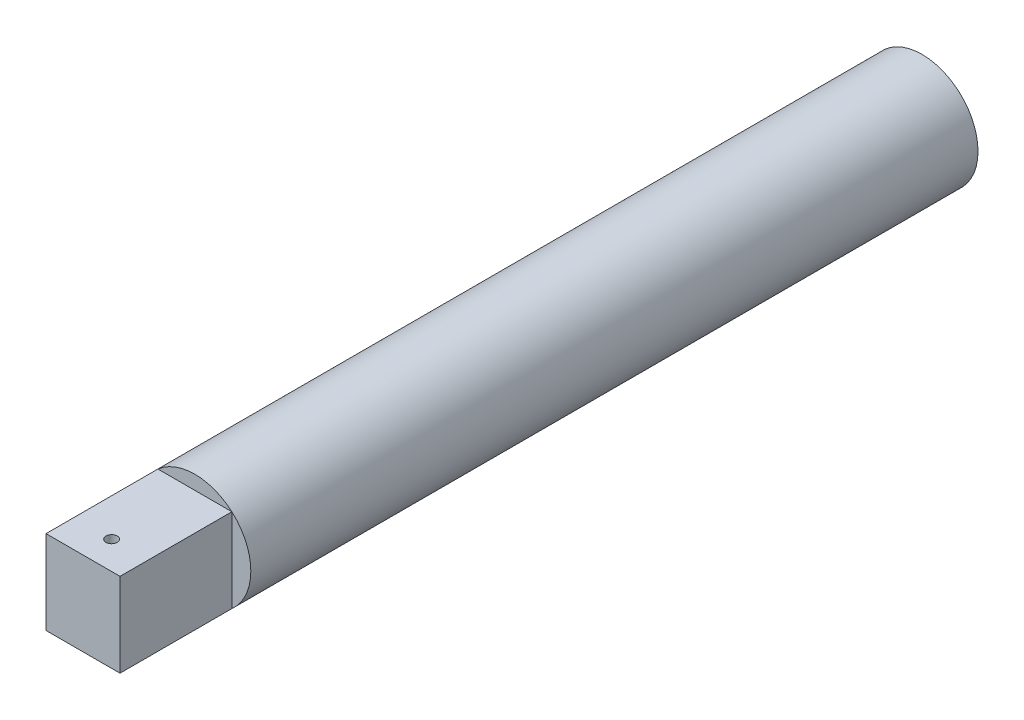
from build123d import *

# Parameters (mm, degrees)
SKETCH1_R           = 10
BOSS_EXTRUDE1_DEPTH = 150
CUT_EXTRUDE1_START  = -20
CUT_EXTRUDE1_DEPTH  = 20
SKETCH3_3_R         = 1
CUT_EXTRUDE4_DEPTH  = 152.348108677
SKETCH7_R           = 1
CUT_EXTRUDE5_DEPTH  = 10


with BuildPart() as part:
    # Sketch1 → Boss-Extrude1 (new body)
    with BuildSketch(Plane.XY):
        Circle(SKETCH1_R)
    extrude(amount=BOSS_EXTRUDE1_DEPTH)

    # Sketch2 → Cut-Extrude1 (cut)
    with BuildSketch(Plane.XY.offset(150).offset(CUT_EXTRUDE1_START)):
        with BuildLine():
            ThreePointArc((6.614378278, 7.5), (0, 10), (-6.614378278, 7.5))
            Line((-6.614378278, 7.5), (6.614378278, 7.5))
        make_face()
        with BuildLine():
            Line((-6.614378278, -7.5), (-6.614378278, 7.5))
            ThreePointArc((-6.614378278, 7.5), (-10, 0), (-6.614378278, -7.5))
        make_face()
        with BuildLine():
            ThreePointArc((6.614378278, -7.5), (10, 0), (6.614378278, 7.5))
            Line((6.614378278, 7.5), (6.614378278, -7.5))
        make_face()
        with BuildLine():
            Line((6.614378278, -7.5), (-6.614378278, -7.5))
            ThreePointArc((-6.614378278, -7.5), (0, -10), (6.614378278, -7.5))
        make_face()
    extrude(amount=CUT_EXTRUDE1_DEPTH, mode=Mode.SUBTRACT)

    # Sketch3<3> → Cut-Extrude4 (cut, through all)
    with BuildSketch(Plane(origin=(0, 7.5, 0), x_dir=(1, 0, 0), z_dir=(0, 1, 0))):
        with Locations((0.114378278, -145)):
            Circle(SKETCH3_3_R)
    extrude(amount=-CUT_EXTRUDE4_DEPTH, mode=Mode.SUBTRACT)

    # Sketch7 → Cut-Extrude5 (cut)
    with BuildSketch(Plane(origin=(0, 0, 0), x_dir=(-1, 0, 0), z_dir=(0, 0, -1))):
        with Locations((5, 0)):
            Circle(SKETCH7_R)
        with Locations((-5, 0)):
            Circle(SKETCH7_R)
    extrude(amount=-CUT_EXTRUDE5_DEPTH, mode=Mode.SUBTRACT)


solid = part.part
